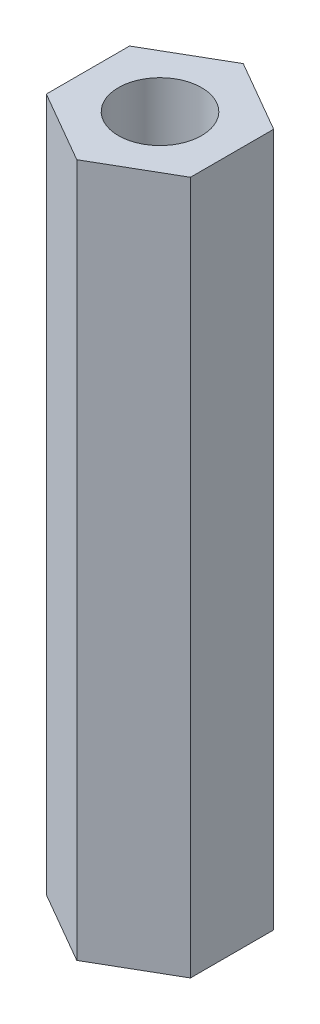
from build123d import *

# Parameters (mm, degrees)
SKETCH1_R           = 1.5
BOSS_EXTRUDE1_DEPTH = 25


with BuildPart() as part:
    # Sketch1 → Boss-Extrude1 (new body)
    with BuildSketch(Plane(origin=(0, 0, 0), x_dir=(1, 0, 0), z_dir=(0, 1, 0))):
        Polygon((0, 3), (-2.598076211, 1.5), (-2.598076211, -1.5), (0, -3), (2.598076211, -1.5), (2.598076211, 1.5), align=None)
        Circle(SKETCH1_R, mode=Mode.SUBTRACT)
    extrude(amount=BOSS_EXTRUDE1_DEPTH)


solid = part.part
